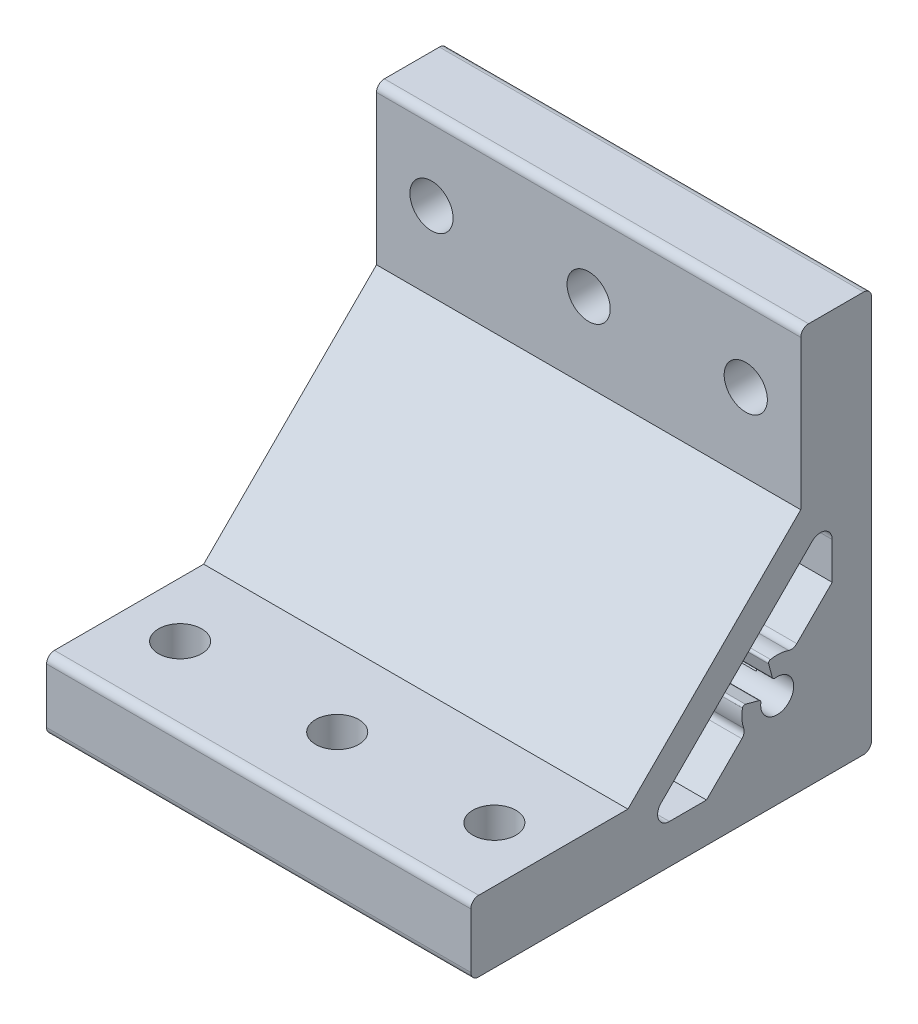
from build123d import *

# Parameters (mm, degrees)
BOSS_EXTRUDE1_DEPTH      = 27
BOSS_EXTRUDE1_DEPTH_BACK = 27
SKETCH6_R                = 2.75
CUT_EXTRUDE5_DEPTH       = 72.37226352
SKETCH7_R                = 2.75
CUT_EXTRUDE6_DEPTH       = 72.37226352
SKETCH9_R                = 2.4
CUT_EXTRUDE7_DEPTH       = 10


with BuildPart() as part:
    # Sketch1 → Boss-Extrude1 (new, two sides: drawn at the far end of the back side and taken through both)
    with BuildSketch(Plane(origin=(0, 0, 0), x_dir=(0, 0, -1), z_dir=(1, 0, 0)).offset(-BOSS_EXTRUDE1_DEPTH_BACK)):
        with BuildLine():
            Line((-50, 0), (-1, 0))
            ThreePointArc((-1, 0), (-0.292893219, 0.292893219), (0, 1))
            Line((0, 1), (0, 50))
            ThreePointArc((0, 50), (-0.292893219, 50.707106781), (-1, 51))
            Line((-1, 51), (-8, 51))
            ThreePointArc((-8, 51), (-8.707106781, 50.707106781), (-9, 50))
            Line((-9, 50), (-9, 31))
            Line((-9, 31), (-31, 9))
            Line((-31, 9), (-50, 9))
            ThreePointArc((-50, 9), (-50.707106781, 8.707106781), (-51, 8))
            Line((-51, 8), (-51, 1))
            ThreePointArc((-51, 1), (-50.707106781, 0.292893219), (-50, 0))
        make_face()
        with BuildLine():
            Line((-25.721825407, 5), (-20.999285733, 5))
            Line((-20.999285733, 5), (-16.494036438, 9.505249294))
            ThreePointArc((-16.494036438, 9.505249294), (-16.226979866, 9.987090789), (-16.255625497, 10.537245192))
            ThreePointArc((-16.255625497, 10.537245192), (-16.488859314, 11.683547702), (-16.418755424, 12.851234691))
            ThreePointArc((-16.418755424, 12.851234691), (-16.283360667, 13.048766752), (-16.046526031, 13.084263382))
            Line((-16.046526031, 13.084263382), (-14.300039569, 12.616293745))
            ThreePointArc((-14.300039569, 12.616293745), (-14.127781033, 12.492491496), (-14.080474622, 12.285701498))
            ThreePointArc((-14.080474622, 12.285701498), (-10.515075745, 10.515075774), (-12.285701539, 14.080474617))
            ThreePointArc((-12.285701539, 14.080474617), (-12.492491514, 14.127781045), (-12.616293745, 14.300039569))
            Line((-12.616293745, 14.300039569), (-13.084263382, 16.046526031))
            ThreePointArc((-13.084263382, 16.046526031), (-13.048766728, 16.283360705), (-12.851234602, 16.418755442))
            ThreePointArc((-12.851234602, 16.418755442), (-11.683774102, 16.488875269), (-10.537674556, 16.255773055))
            ThreePointArc((-10.537674556, 16.255773055), (-9.987311976, 16.226928716), (-9.505249294, 16.494036438))
            Line((-9.505249294, 16.494036438), (-5, 20.999285733))
            Line((-5, 20.999285733), (-5, 25.721825407))
            ThreePointArc((-5, 25.721825407), (-5.925974851, 27.107644706), (-7.560660172, 26.782485579))
            Line((-7.560660172, 26.782485579), (-26.782485579, 7.560660172))
            ThreePointArc((-26.782485579, 7.560660172), (-27.107644706, 5.925974851), (-25.721825407, 5))
        make_face(mode=Mode.SUBTRACT)
    extrude(amount=BOSS_EXTRUDE1_DEPTH + BOSS_EXTRUDE1_DEPTH_BACK)

    # Sketch6 → Cut-Extrude5 (cut, through all)
    with BuildSketch(Plane.XY.offset(9)):
        with Locations((-20, 41)):
            Circle(SKETCH6_R)
        with Locations((0, 41)):
            Circle(SKETCH6_R)
        with Locations((20, 41)):
            Circle(SKETCH6_R)
    extrude(amount=-CUT_EXTRUDE5_DEPTH, mode=Mode.SUBTRACT)

    # Sketch7 → Cut-Extrude6 (cut, through all)
    with BuildSketch(Plane(origin=(0, 9, 0), x_dir=(-1, 0, 0), z_dir=(0, 1, 0))):
        with Locations((20, 41)):
            Circle(SKETCH7_R)
        with Locations((0, 41)):
            Circle(SKETCH7_R)
        with Locations((-20, 41)):
            Circle(SKETCH7_R)
    extrude(amount=-CUT_EXTRUDE6_DEPTH, mode=Mode.SUBTRACT)

    # Sketch9 → Cut-Extrude7 (cut)
    with BuildSketch(Plane(origin=(0, 0, 0), x_dir=(-1, 0, 0), z_dir=(0, 0, -1))):
        with Locations((20, 12)):
            Circle(SKETCH9_R)
        with Locations((-20, 12)):
            Circle(SKETCH9_R)
        with Locations((0, 12)):
            Circle(SKETCH9_R)
    extrude(amount=-CUT_EXTRUDE7_DEPTH, mode=Mode.SUBTRACT)


solid = part.part
